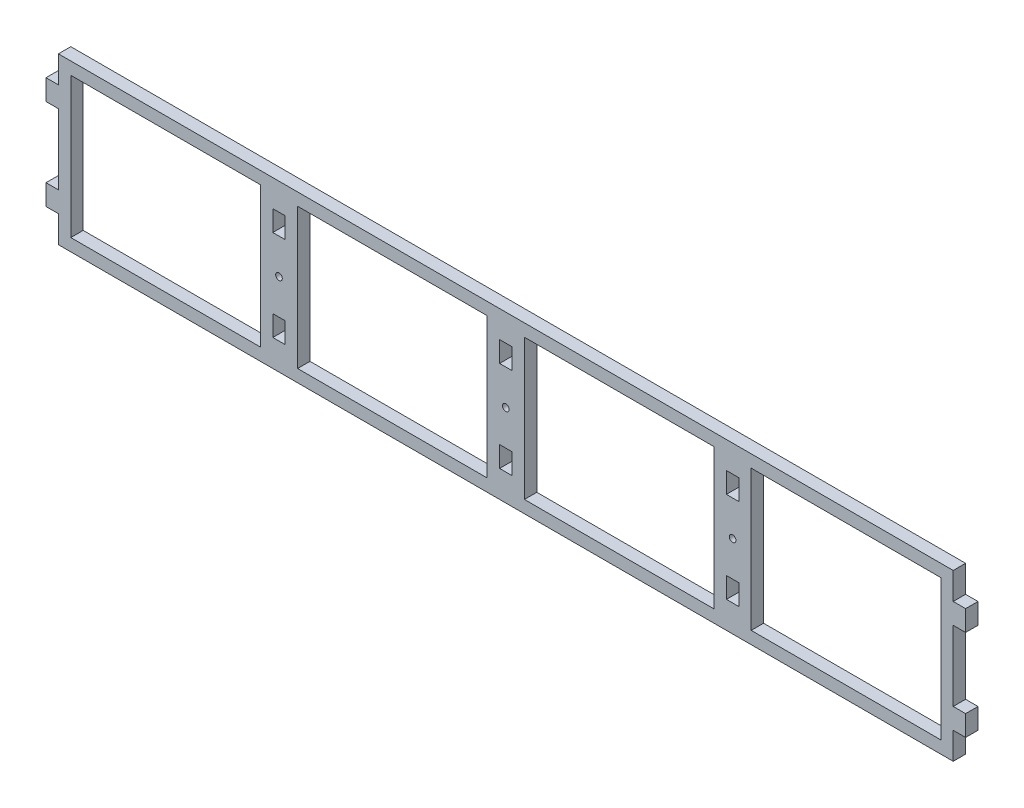
from build123d import *

# Parameters (mm, degrees)
SKETCH1_W           = 433
SKETCH1_H           = 80
BOSS_EXTRUDE1_DEPTH = 6
CUT_EXTRUDE1_REACH  = 222.246
SKETCH2_W           = 91.75
SKETCH2_H           = 68
LPATTERN1_COUNT     = 4
LPATTERN1_PITCH     = 109.75
SKETCH3_R           = 1.6
SKETCH3_W           = 6
SKETCH3_H           = 10
CUT_EXTRUDE2_DEPTH  = 221.245885319
SKETCH4_W           = 6
SKETCH4_H           = 10
BOSS_EXTRUDE2_DEPTH = 6


with BuildPart() as part:
    # Sketch1 → Boss-Extrude1 (new body)
    with BuildSketch(Plane.XY):
        Rectangle(SKETCH1_W, SKETCH1_H)
    extrude(amount=BOSS_EXTRUDE1_DEPTH)

    # Sketch2 → Cut-Extrude1 (cut, up to next)
    with BuildSketch(Plane.XY.offset(6), mode=Mode.PRIVATE) as cut_extrude1_sk1:
        with Locations((-164.625, 0)):
            Rectangle(SKETCH2_W, SKETCH2_H)
    cut_extrude1_tool1 = extrude(cut_extrude1_sk1.sketch, amount=-CUT_EXTRUDE1_REACH, mode=Mode.PRIVATE) & part.part
    cut_extrude1 = cut_extrude1_tool1.solids().sort_by_distance((-164.625, 0, 6))[0]
    add(cut_extrude1, mode=Mode.SUBTRACT)

    # LPattern1: Cut-Extrude1 ×4
    with Locations(*[(i * LPATTERN1_PITCH, 0, 0) for i in range(1, LPATTERN1_COUNT)]):
        add(cut_extrude1, mode=Mode.SUBTRACT)

    # Sketch3 → Cut-Extrude2 (cut, through all)
    with BuildSketch(Plane(origin=(0, 0, 0), x_dir=(-1, 0, 0), z_dir=(0, 0, -1))):
        with Locations((109.75, 0)):
            Circle(SKETCH3_R)
        Circle(SKETCH3_R)
        with Locations((-109.75, 0)):
            Circle(SKETCH3_R)
        with Locations((-109.75, -22)):
            Rectangle(SKETCH3_W, SKETCH3_H)
        with Locations((-109.75, 22)):
            Rectangle(SKETCH3_W, SKETCH3_H)
        with Locations((0, 22)):
            Rectangle(SKETCH3_W, SKETCH3_H)
        with Locations((0, -22)):
            Rectangle(SKETCH3_W, SKETCH3_H)
        with Locations((109.75, 22)):
            Rectangle(SKETCH3_W, SKETCH3_H)
        with Locations((109.75, -22)):
            Rectangle(SKETCH3_W, SKETCH3_H)
    extrude(amount=-CUT_EXTRUDE2_DEPTH, mode=Mode.SUBTRACT)

    # Sketch4 → Boss-Extrude2 (add)
    with BuildSketch(Plane(origin=(0, 0, 0), x_dir=(-1, 0, 0), z_dir=(0, 0, -1))):
        with Locations((-219.5, 22)):
            Rectangle(SKETCH4_W, SKETCH4_H)
        with Locations((-219.5, -22)):
            Rectangle(SKETCH4_W, SKETCH4_H)
        with Locations((219.5, -22)):
            Rectangle(SKETCH4_W, SKETCH4_H)
        with Locations((219.5, 22)):
            Rectangle(SKETCH4_W, SKETCH4_H)
    extrude(amount=-BOSS_EXTRUDE2_DEPTH)


solid = part.part
